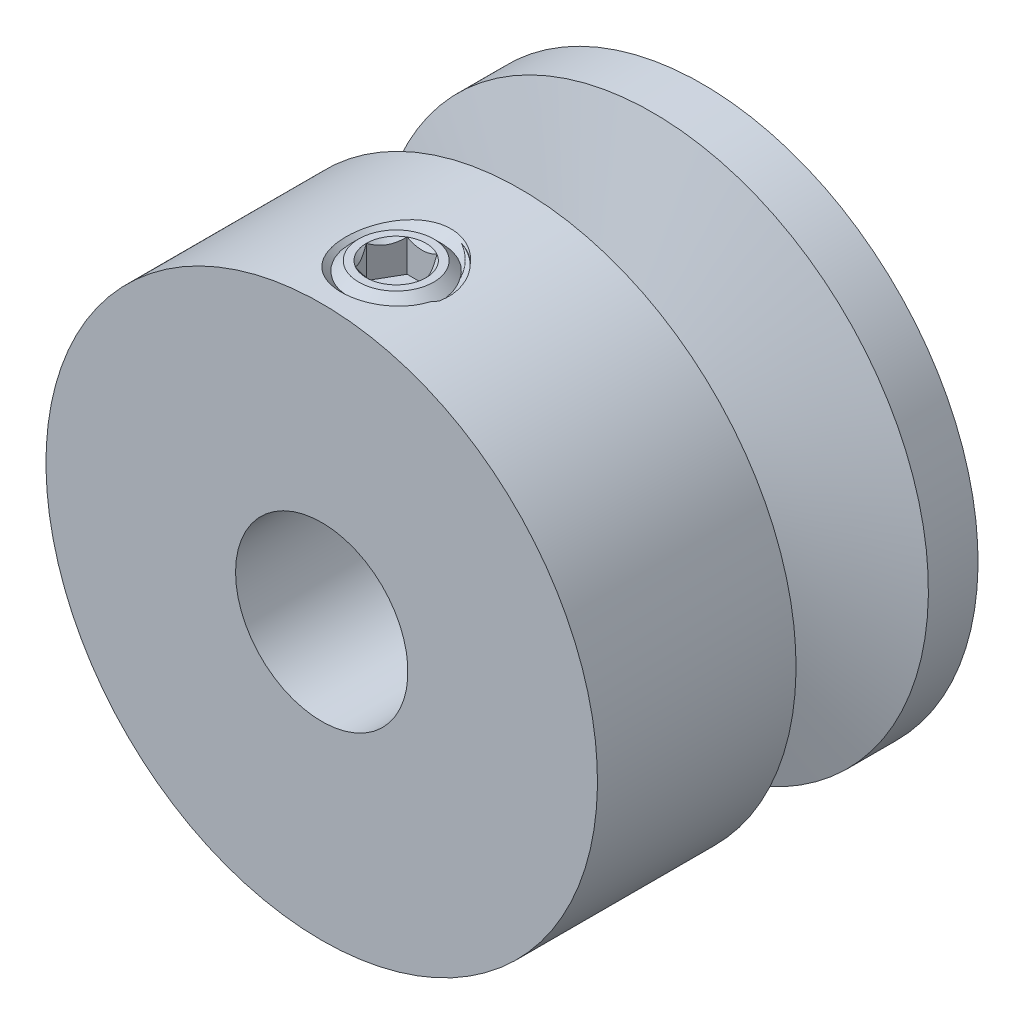
from build123d import *

# Parameters (mm, degrees)
SKETCH2_R               = 3.96875
CUT_EXTRUDE1_DEPTH      = 17.526
CUT_EXTRUDE2_REACH      = 32.905
CUT_EXTRUDE2_END_RADIUS = 3.96875
SKETCH3_R               = 1.751541667
CUT_SWEEP1_PITCH        = 1.058333333
CUT_EXTRUDE4_DEPTH      = 1.48828125


with BuildPart() as part:
    # Sketch1 → Revolve1 (revolve)
    with BuildSketch(Plane(origin=(0, 0, 0), x_dir=(0, 0, -1), z_dir=(1, 0, 0)), mode=Mode.PRIVATE) as revolve1_sk:
        Polygon((-12.192, 12.7), (-3.048, 12.7), (-1.2271668, 6.35), (1.2271668, 6.35), (3.048, 12.7), (5.334, 12.7), (5.334, 0), (-12.192, 0), align=None)
    revolve(revolve1_sk.sketch.rotate(Axis((0, 0, 12.192), (0, 0, -1)), 180), axis=Axis((0, 0, 12.192), (0, 0, -1)))

    # Sketch2 → Cut-Extrude1 (cut)
    with BuildSketch(Plane(origin=(0, 0, -5.334), x_dir=(-1, 0, 0), z_dir=(0, 0, -1))):
        Circle(SKETCH2_R)
    extrude(amount=-CUT_EXTRUDE1_DEPTH, mode=Mode.SUBTRACT)

    # Cut-Extrude2: up to this cylinder (the profile starts outside it)
    cut_extrude2_end = Plane(origin=(0, 0, 8.763), z_dir=(0, 0, -1)) * Cylinder(CUT_EXTRUDE2_END_RADIUS, 74.7475, mode=Mode.PRIVATE)
    # Sketch3 → Cut-Extrude2 (cut, up to the surface)
    with BuildSketch(Plane(origin=(0, 12.7, 0), x_dir=(-1, 0, 0), z_dir=(0, 1, 0)), mode=Mode.PRIVATE) as cut_extrude2_sk1:
        with Locations(Location((0, 8.763, 0), (0, 0, 90))):
            Circle(SKETCH3_R)
    cut_extrude2_tool1 = extrude(cut_extrude2_sk1.sketch, amount=-CUT_EXTRUDE2_REACH, mode=Mode.PRIVATE) - cut_extrude2_end
    add(cut_extrude2_tool1.solids().sort_by_distance((0, 12.7, 8.763))[0], mode=Mode.SUBTRACT)

    # Cut-Sweep1: the profile of Sketch5 screwed along a right-hand helix of 13 turns, 8 arcs to a turn; built about Z, then put on its axis
    cut_sweep1_z = Axis((0, 0, 0), (0, 0, 1))
    cut_sweep1_corners = [(1.668308364, 0, -1.025260417), (1.668308364, 0, -0.033072917), (2.413, 0, -0.463020833), (2.413, 0, -0.5953125)]
    with BuildLine(mode=Mode.PRIVATE) as cut_sweep1_profile:
        Line(cut_sweep1_corners[0], cut_sweep1_corners[1])
        Line(cut_sweep1_corners[1], cut_sweep1_corners[2])
        Line(cut_sweep1_corners[2], cut_sweep1_corners[3])
        Line(cut_sweep1_corners[3], cut_sweep1_corners[0])
    cut_sweep1_cap = Face(cut_sweep1_profile.wire())
    cut_sweep1_turn_angles = [0, 22.5, 45, 67.5, 90, 112.5, 135, 157.5, 180, 202.5, 225, 247.5, 270, 292.5, 315, 337.5, 360]
    cut_sweep1_turn_weights = [1, 0.9238795325112867, 1, 0.9238795325112867, 1, 0.9238795325112867, 1, 0.9238795325112867, 1, 0.9238795325112867, 1, 0.9238795325112867, 1, 0.9238795325112867, 1, 0.9238795325112867, 1]
    cut_sweep1_turn_rails = [Edge.make_bspline([Vector(p[0], p[1], 0).rotate(cut_sweep1_z, cut_sweep1_turn_angles[k]) / cut_sweep1_turn_weights[k] + Vector(0, 0, p[2] + CUT_SWEEP1_PITCH * cut_sweep1_turn_angles[k] / 360) for k in range(17)], [0, 0, 0, 1, 1, 2, 2, 3, 3, 4, 4, 5, 5, 6, 6, 7, 7, 8, 8, 8], 2, cut_sweep1_turn_weights) for p in cut_sweep1_corners]
    cut_sweep1_turn_sides = [Face.make_surface_from_curves(cut_sweep1_turn_rails[p[0]], cut_sweep1_turn_rails[p[1]]) for p in [(0, 1), (1, 2), (2, 3), (3, 0)]]
    cut_sweep1 = Plane(origin=(0, 12.7, 8.763), x_dir=(0, 0, 1), z_dir=(0, -1, 0)) * Solid(Shell([*[p.moved(Location((0, 0, CUT_SWEEP1_PITCH * i))) for i in range(13) for p in cut_sweep1_turn_sides], cut_sweep1_cap, cut_sweep1_cap.rotate(cut_sweep1_z, 4680).moved(Location((0, 0, CUT_SWEEP1_PITCH * 4680 / 360)))]))
    add(cut_sweep1, mode=Mode.SUBTRACT)

    # Cut-Extrude3 cone 1 section (through the dimple's axis) → Cut-Extrude3 (revolve, cut)
    with BuildSketch(Plane(origin=(0, 12.7, 8.763), x_dir=(0, 0, 1), z_dir=(1, 0, 0))):
        Polygon((0, 0), (2.527567944, 0), (0, 2.527567944), align=None)
    revolve(axis=Axis((0, 12.7, 8.763), (0, -1, 0)), mode=Mode.SUBTRACT)


with BuildPart() as body_2:
    # Sketch7 → Revolve2 (revolve)
    with BuildSketch(Plane(origin=(0, 0, 0), x_dir=(0, 0, -1), z_dir=(1, 0, 0))):
        Polygon((-11.176, 7.037407664), (-11.176, 12.012592336), (-10.488592336, 12.7), (-8.763, 12.7), (-8.763, 6.35), (-10.488592336, 6.35), align=None)
    revolve(axis=Axis((0, 12.7, 8.763), (0, -1, 0)))

    # Sketch8 → Cut-Extrude4 (cut)
    with BuildSketch(Plane(origin=(0, 12.7, 0), x_dir=(1, 0, 0), z_dir=(0, 1, 0))):
        Polygon((1.374815329, -8.763), (0.687407664, -7.572375), (-0.687407664, -7.572375), (-1.374815329, -8.763), (-0.687407664, -9.953625), (0.687407664, -9.953625), align=None)
    extrude(amount=-CUT_EXTRUDE4_DEPTH, mode=Mode.SUBTRACT)

    # Cut-Extrude5 cone 1 section (through the dimple's axis) → Cut-Extrude5 (revolve, cut)
    with BuildSketch(Plane(origin=(0, 12.7, 8.763), x_dir=(0, 0, 1), z_dir=(1, 0, 0))):
        Polygon((0, 0), (1.374815329, 0), (0, 1.374815329), align=None)
    revolve(axis=Axis((0, 12.7, 8.763), (0, -1, 0)), mode=Mode.SUBTRACT)


solid = Compound([part.part, body_2.part])
